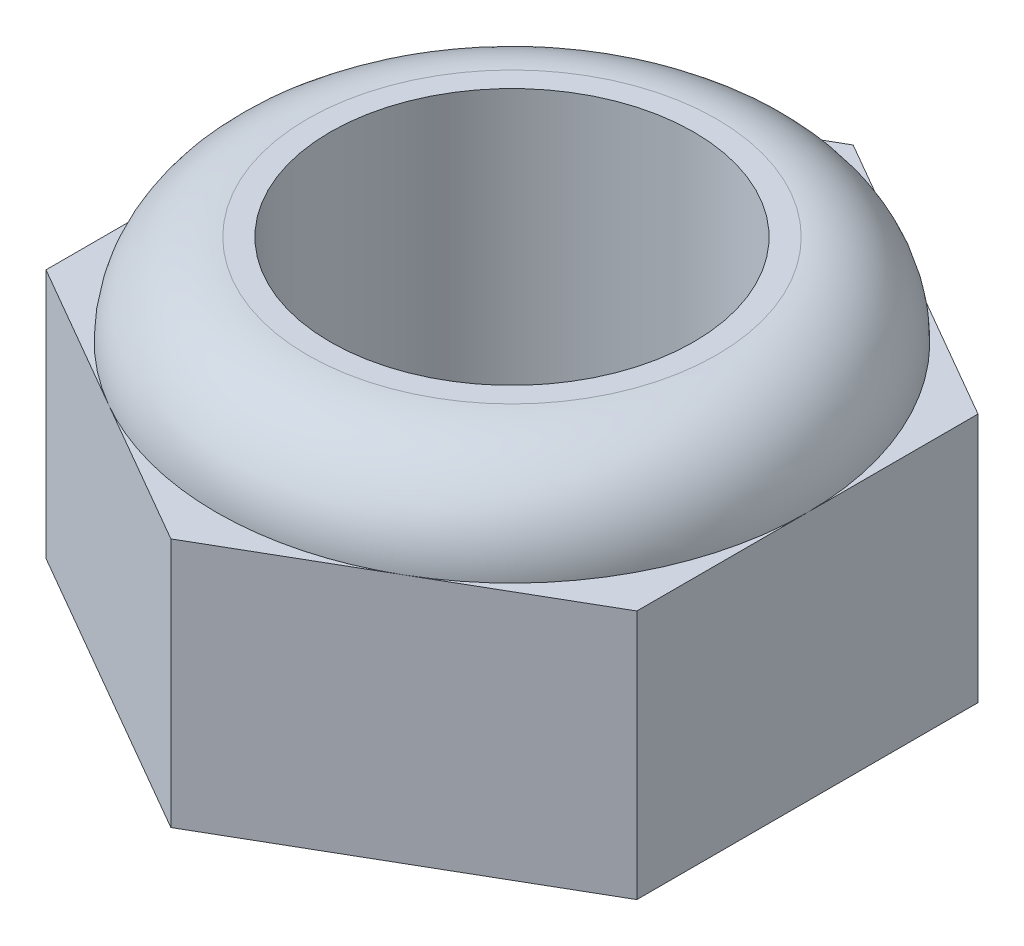
from build123d import *

# Parameters (mm, degrees)
SKETCH1_R           = 4
BOSS_EXTRUDE1_DEPTH = 5.5
SKETCH2_R           = 6.5
SKETCH2_R_2         = 4
BOSS_EXTRUDE2_DEPTH = 2
FILLET1_R           = 2


with BuildPart() as part:
    # Sketch1 → Boss-Extrude1 (new body)
    with BuildSketch(Plane(origin=(0, 0, 0), x_dir=(1, 0, 0), z_dir=(0, 1, 0))):
        Polygon((6.5, -3.75277675), (6.5, 3.75277675), (0, 7.505553499), (-6.5, 3.75277675), (-6.5, -3.75277675), (0, -7.505553499), align=None)
        with Locations(Location((0, 0, 0), (0, 0, 270))):
            Circle(SKETCH1_R, mode=Mode.SUBTRACT)
    extrude(amount=BOSS_EXTRUDE1_DEPTH)

    # Sketch2 → Boss-Extrude2 (add)
    with BuildSketch(Plane(origin=(0, 5.5, 0), x_dir=(1, 0, 0), z_dir=(0, 1, 0))):
        with Locations(Location((0, 0, 0), (0, 0, 60))):
            Circle(SKETCH2_R)
        with Locations(Location((0, 0, 0), (0, 0, 270))):
            Circle(SKETCH2_R_2, mode=Mode.SUBTRACT)
    extrude(amount=BOSS_EXTRUDE2_DEPTH)

    # Fillet1
    fillet1_edges = [part.edges().sort_by_distance(p)[0] for p in [
        (-3.25, 7.5, 5.629165125),
    ]]
    fillet(fillet1_edges, radius=FILLET1_R - 0.0001)  # a hair under: the kernel refuses the full size


solid = part.part
